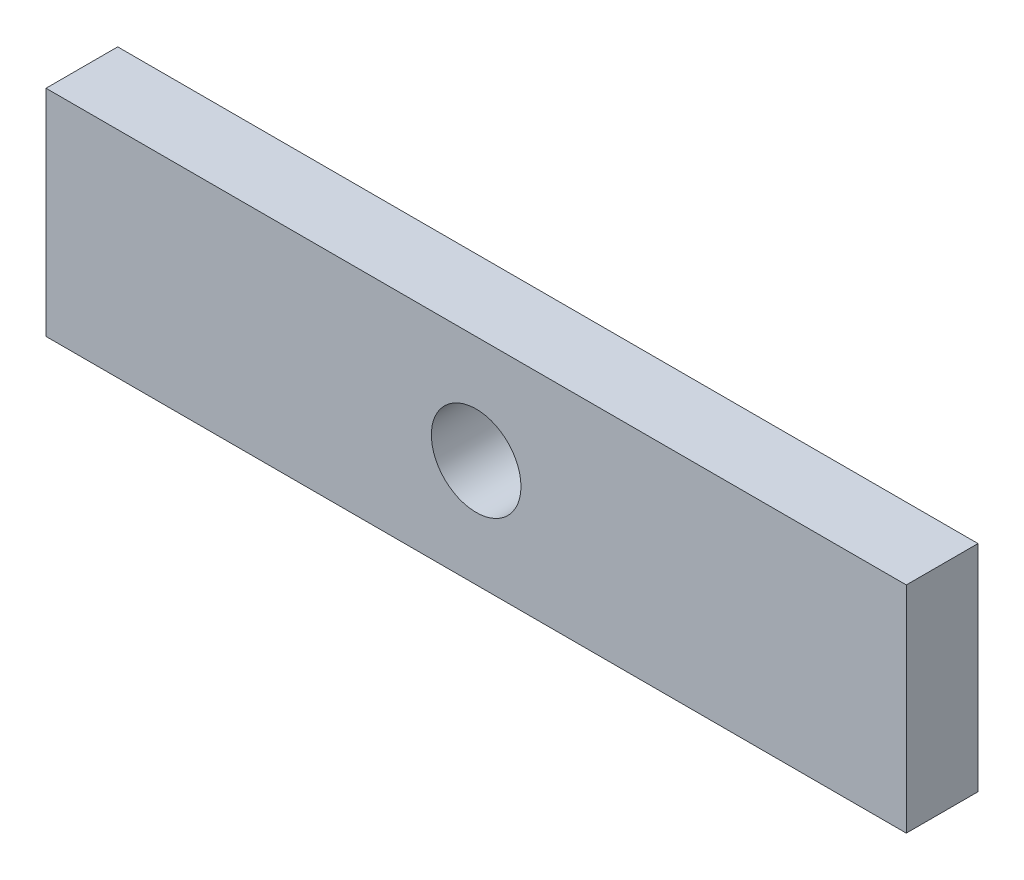
from build123d import *

# Parameters (mm, degrees)
SKETCH2_W           = 48
SKETCH2_H           = 11.994
SKETCH2_R           = 2.5
BOSS_EXTRUDE1_DEPTH = 4


with BuildPart() as part:
    # Sketch2 → Boss-Extrude1 (new body)
    with BuildSketch(Plane.XY.offset(-20.330125775)):
        with Locations((35.591789557, -12.549679152)):
            Rectangle(SKETCH2_W, SKETCH2_H)
        with Locations((35.591789557, -12.549679152)):
            Circle(SKETCH2_R, mode=Mode.SUBTRACT)
    extrude(amount=BOSS_EXTRUDE1_DEPTH)


solid = part.part
